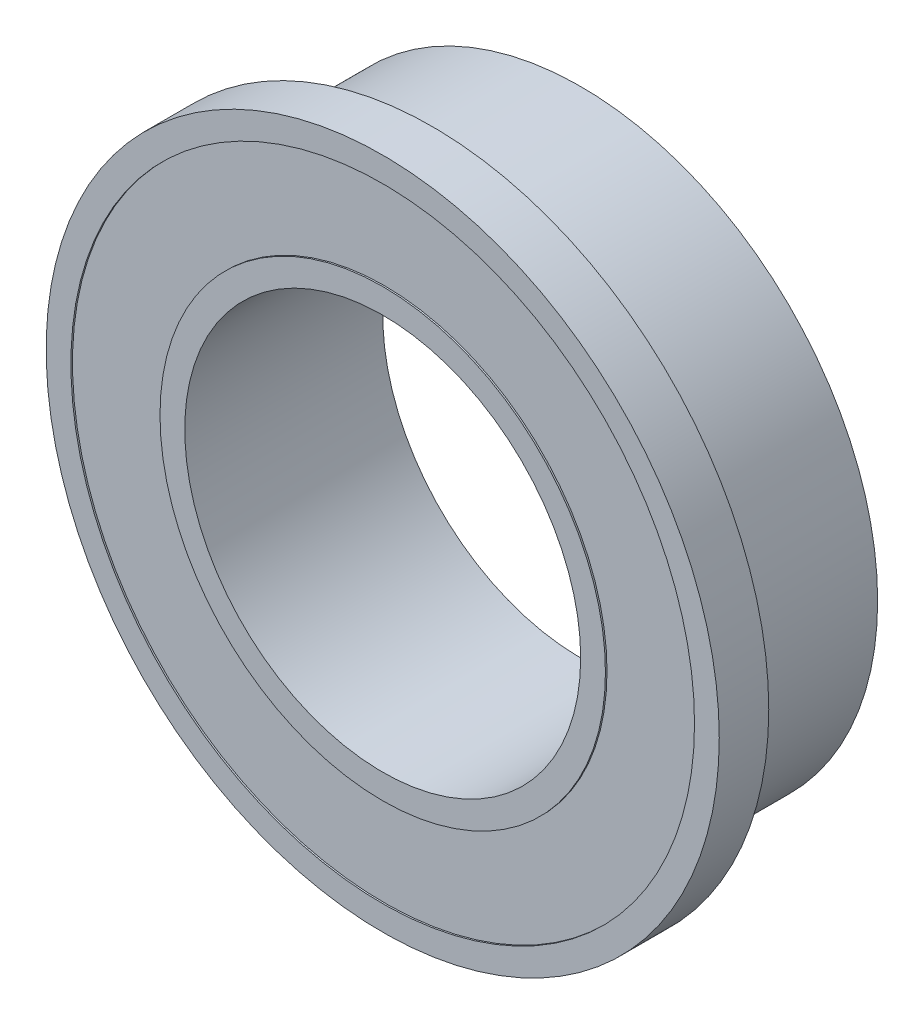
from build123d import *

# Parameters (mm, degrees)
SKETCH1_R           = 4.7625
SKETCH1_R_2         = 3.175
BOSS_EXTRUDE1_DEPTH = 3.175
BOSS_EXTRUDE2_START = -0.79375
SKETCH2_R           = 5.3975
SKETCH2_R_2         = 4.7625
BOSS_EXTRUDE2_DEPTH = 0.79375
SKETCH3_R           = 5.000625
SKETCH3_R_2         = 3.571875
CUT_EXTRUDE1_DEPTH  = 0.0254
CUT_EXTRUDE2_START  = -0.0254
SKETCH4_R           = 4.365625
SKETCH4_R_2         = 3.571875
CUT_EXTRUDE2_DEPTH  = 0.0254


with BuildPart() as part:
    # Sketch1 → Boss-Extrude1 (new body)
    with BuildSketch(Plane.XY):
        Circle(SKETCH1_R)
        Circle(SKETCH1_R_2, mode=Mode.SUBTRACT)
    extrude(amount=BOSS_EXTRUDE1_DEPTH)

    # Sketch2 → Boss-Extrude2 (add)
    with BuildSketch(Plane.XY.offset(3.175).offset(BOSS_EXTRUDE2_START)):
        Circle(SKETCH2_R)
        Circle(SKETCH2_R_2, mode=Mode.SUBTRACT)
    extrude(amount=BOSS_EXTRUDE2_DEPTH)

    # Sketch3 → Cut-Extrude1 (cut)
    with BuildSketch(Plane.XY.offset(3.175)):
        Circle(SKETCH3_R)
        Circle(SKETCH3_R_2, mode=Mode.SUBTRACT)
    extrude(amount=-CUT_EXTRUDE1_DEPTH, mode=Mode.SUBTRACT)

    # Sketch4 → Cut-Extrude2 (cut)
    with BuildSketch(Plane(origin=(0, 0, 0), x_dir=(-1, 0, 0), z_dir=(0, 0, -1)).offset(CUT_EXTRUDE2_START)):
        Circle(SKETCH4_R)
        Circle(SKETCH4_R_2, mode=Mode.SUBTRACT)
    extrude(amount=CUT_EXTRUDE2_DEPTH, mode=Mode.SUBTRACT)


solid = part.part
